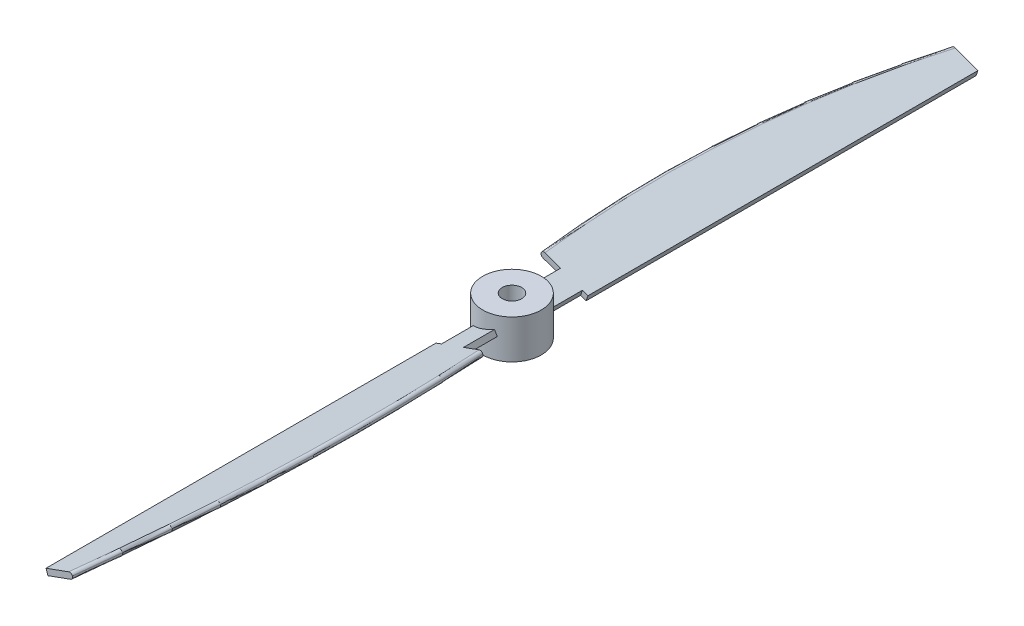
from build123d import *

# Parameters (mm, degrees)
SKETCH1_R                = 15
SKETCH1_R_2              = 5
BOSS_EXTRUDE1_DEPTH      = 10
BOSS_EXTRUDE2_DEPTH      = 1.5
FILLET1_R                = 1.5
CIRPATTERN1_COUNT        = 2
FILLET1_OF_CIRPATTERN1_R = 1.5


with BuildPart() as part:
    # Sketch1 → Boss-Extrude1 (new, symmetric)
    with BuildSketch(Plane(origin=(0, 0, 0), x_dir=(1, 0, 0), z_dir=(0, 1, 0))):
        with Locations(Location((0, 0, 0), (0, 0, 270))):
            Circle(SKETCH1_R)
        with Locations(Location((0, 0, 0), (0, 0, 270))):
            Circle(SKETCH1_R_2, mode=Mode.SUBTRACT)
    extrude(amount=BOSS_EXTRUDE1_DEPTH, both=True)

    # Sketch3 → Boss-Extrude2 (add, symmetric)
    with BuildSketch(Plane(origin=(0, 0, 0), x_dir=(-0.9396926207859095, 0.34202014332566577, 0), z_dir=(0.34202014332566577, 0.9396926207859095, 0))):
        with BuildLine():
            Line((6, -13), (6, -30))
            Line((6, -30), (16, -30))
            ThreePointArc((16, -30), (17.972915249, -130.416666562), (4.913090625, -230))
            Line((4.913090625, -230), (-9, -230))
            Line((-9, -230), (-9, -30))
            Line((-9, -30), (-6, -30))
            Line((-6, -30), (-6, -13))
            ThreePointArc((-6, -13), (0, -14.094026279), (6, -13))
        make_face()
    boss_extrude2 = extrude(amount=BOSS_EXTRUDE2_DEPTH, both=True)

    # Fillet1
    fillet1_edges = [part.edges().sort_by_distance(p)[0] for p in [
        (-16.375985619, 7.556637981, -130.416666562),
        (-17.402046049, 4.737560118, -130.416666562),
    ]]
    fillet(fillet1_edges, radius=FILLET1_R - 0.0001)  # a hair under: the kernel refuses the full size

    # CirPattern1: Boss-Extrude2 ×2 about axis
    cirpattern1_axis = Axis((0, 0, 0), (0, 1, 0))
    for i in range(1, CIRPATTERN1_COUNT):
        add(boss_extrude2.rotate(cirpattern1_axis, i * 360 / CIRPATTERN1_COUNT))

    # Fillet1 of CirPattern1
    fillet1_of_cirpattern1_edges = [part.edges().sort_by_distance(p)[0] for p in [
        (16.375985619, 7.556637981, 130.416666562),
        (17.402046049, 4.737560118, 130.416666562),
    ]]
    fillet(fillet1_of_cirpattern1_edges, radius=FILLET1_OF_CIRPATTERN1_R - 0.0001)  # a hair under: the kernel refuses the full size


solid = part.part
